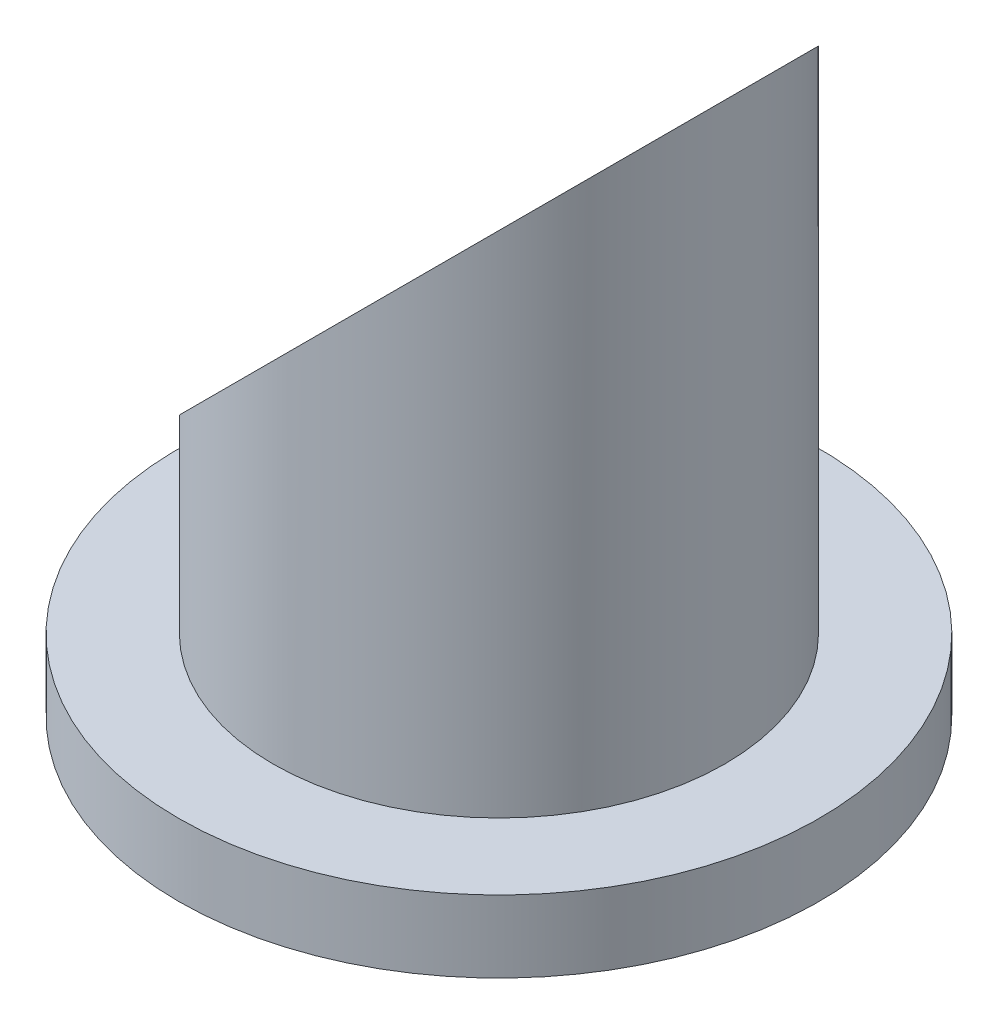
from build123d import *

# Parameters (mm, degrees)
SKETCH1_R               = 8.9
BOSS_EXTRUDE1_DEPTH     = 2
SKETCH2_R               = 6.28
BOSS_EXTRUDE2_DEPTH     = 20
CUT_EXTRUDE1_DEPTH      = 26.346005602
CUT_EXTRUDE1_DEPTH_BACK = 26.346005602


with BuildPart() as part:
    # Sketch1 → Boss-Extrude1 (new body)
    with BuildSketch(Plane(origin=(0, 0, 0), x_dir=(1, 0, 0), z_dir=(0, 1, 0))):
        Circle(SKETCH1_R)
    extrude(amount=BOSS_EXTRUDE1_DEPTH)

    # Sketch2 → Boss-Extrude2 (add)
    with BuildSketch(Plane(origin=(0, 2, 0), x_dir=(1, 0, 0), z_dir=(0, 1, 0))):
        Circle(SKETCH2_R)
    extrude(amount=BOSS_EXTRUDE2_DEPTH)

    # Sketch3 → Cut-Extrude1 (cut, two sides: drawn at the far end of the back side and taken through both)
    with BuildSketch(Plane.XY.offset(-CUT_EXTRUDE1_DEPTH_BACK)):
        Polygon((-6.28, 28.771900514), (-6.28, 5.42), (6.28, 17.98), (6.28, 28.771900514), align=None)
    extrude(amount=CUT_EXTRUDE1_DEPTH + CUT_EXTRUDE1_DEPTH_BACK, mode=Mode.SUBTRACT)


solid = part.part
